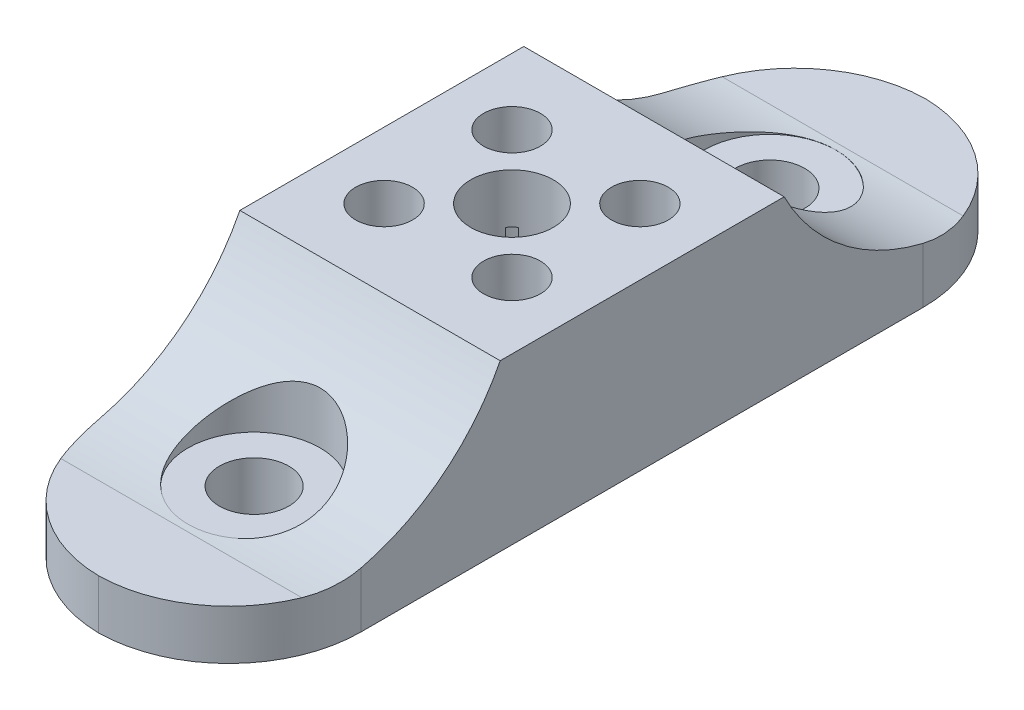
from build123d import *

# Parameters (mm, degrees)
SKETCH1_W               = 20
SKETCH1_H               = 63.5
BOSS_EXTRUDE1_DEPTH     = 12.7
SKETCH2_R               = 3.175
SKETCH2_R_2             = 2.1844
CUT_EXTRUDE1_DEPTH      = 36.62797356
CUT_EXTRUDE2_DEPTH      = 36.62797356
CUT_EXTRUDE2_DEPTH_BACK = 36.62797356
SKETCH4_R               = 3.81
CUT_EXTRUDE3_DEPTH      = 8.89
SKETCH4_3_R             = 3.81
SKETCH4_3_R_2           = 2.1844
SKETCH4_3_R_3           = 5.334
SKETCH4_3_R_4           = 3.175
CUT_EXTRUDE4_DEPTH      = 3.81
CUT_EXTRUDE5_REACH      = 36.454
SKETCH6_R               = 5.08
SKETCH6_R_2             = 2.667
CUT_EXTRUDE6_DEPTH      = 10
CUT_EXTRUDE6_DEPTH_BACK = 35.454239272
SKETCH6_4_R             = 2.159
SKETCH6_4_R_2           = 2.667
FILLET1_R               = 10.16


with BuildPart() as part:
    # Sketch1 → Boss-Extrude1 (new body)
    with BuildSketch(Plane(origin=(0, 0, 0), x_dir=(1, 0, 0), z_dir=(0, 1, 0))):
        Rectangle(SKETCH1_W, SKETCH1_H)
    extrude(amount=BOSS_EXTRUDE1_DEPTH)

    # Sketch2 → Cut-Extrude1 (cut, through all)
    with BuildSketch(Plane(origin=(0, 12.7, 0), x_dir=(1, 0, 0), z_dir=(0, 1, 0))):
        with Locations(Location((0, 0, 0), (0, 0, 270))):
            Circle(SKETCH2_R)
        with Locations(Location((-4.912200098, 4.912200098, 0), (0, 0, 270))):
            Circle(SKETCH2_R_2)
        with Locations(Location((4.912200098, -4.912200098, 0), (0, 0, 270))):
            Circle(SKETCH2_R_2)
        with Locations(Location((4.912200098, 4.912200098, 0), (0, 0, 90))):
            Circle(SKETCH2_R_2)
        with Locations(Location((-4.912200098, -4.912200098, 0), (0, 0, 90))):
            Circle(SKETCH2_R_2)
    extrude(amount=-CUT_EXTRUDE1_DEPTH, mode=Mode.SUBTRACT)

    # Sketch3 → Cut-Extrude2 (cut, two sides: drawn at the far end of the back side and taken through both)
    with BuildSketch(Plane(origin=(0, 0, 0), x_dir=(0, 0, -1), z_dir=(1, 0, 0)).offset(-CUT_EXTRUDE2_DEPTH_BACK)):
        with BuildLine():
            Line((31.75, 3.81), (31.75, 12.7))
            Line((31.75, 12.7), (10.906600098, 12.7))
            ThreePointArc((10.906600098, 12.7), (16.898665682, 6.209564949), (25.4, 3.81))
            Line((25.4, 3.81), (31.75, 3.81))
        make_face()
        with BuildLine():
            ThreePointArc((-25.4, 3.81), (-16.898665682, 6.209564949), (-10.906600098, 12.7))
            Line((-10.906600098, 12.7), (-31.75, 12.7))
            Line((-31.75, 12.7), (-31.75, 3.81))
            Line((-31.75, 3.81), (-25.4, 3.81))
        make_face()
    extrude(amount=CUT_EXTRUDE2_DEPTH + CUT_EXTRUDE2_DEPTH_BACK, mode=Mode.SUBTRACT)

    # Sketch4 → Cut-Extrude3 (cut)
    with BuildSketch(Plane.XZ):
        with Locations((-4.912200098, -4.912200098)):
            Circle(SKETCH4_R)
        with Locations((4.912200098, 4.912200098)):
            Circle(SKETCH4_R)
        with Locations((-4.912200098, 4.912200098)):
            Circle(SKETCH4_R)
        with Locations((4.912200098, -4.912200098)):
            Circle(SKETCH4_R)
    extrude(amount=-CUT_EXTRUDE3_DEPTH, mode=Mode.SUBTRACT)

    # Sketch4<3> → Cut-Extrude4 (cut)
    # profile 1 of 28: a face of its own
    with BuildSketch(Plane.XZ):
        with Locations((-4.912200098, 4.912200098)):
            Circle(SKETCH4_3_R)
        with Locations(Location((-4.912200098, 4.912200098, 0), (0, 0, 270))):
            Circle(SKETCH4_3_R_2, mode=Mode.SUBTRACT)
    # profile 2 of 28: a face of its own
    with BuildSketch(Plane.XZ):
        Circle(SKETCH4_3_R_3)
        with Locations(Location((0, 0, 0), (0, 0, 90))):
            Circle(SKETCH4_3_R_4, mode=Mode.SUBTRACT)
    # profile 3 of 28: a face of its own
    with BuildSketch(Plane.XZ):
        Circle(SKETCH4_3_R_3)
    # profile 4 of 28: a face of its own
    with BuildSketch(Plane.XZ):
        with Locations(Location((-4.912200098, 4.912200098, 0), (0, 0, 270))):
            Circle(SKETCH4_3_R_2)
    # profile 5 of 28: a face of its own
    with BuildSketch(Plane.XZ):
        with Locations((-4.912200098, 4.912200098)):
            Circle(SKETCH4_3_R)
    # profile 6 of 28: a face of its own
    with BuildSketch(Plane.XZ):
        Circle(SKETCH4_3_R_3)
        with Locations(Location((0, 0, 0), (0, 0, 90))):
            Circle(SKETCH4_3_R_4, mode=Mode.SUBTRACT)
    # profile 7 of 28: a face of its own
    with BuildSketch(Plane.XZ):
        with Locations((-4.912200098, -4.912200098)):
            Circle(SKETCH4_3_R)
    # profile 8 of 28: a face of its own
    with BuildSketch(Plane.XZ):
        Circle(SKETCH4_3_R_3)
        with Locations(Location((0, 0, 0), (0, 0, 90))):
            Circle(SKETCH4_3_R_4, mode=Mode.SUBTRACT)
    # profile 9 of 28: a face of its own
    with BuildSketch(Plane.XZ):
        with Locations((-4.912200098, -4.912200098)):
            Circle(SKETCH4_3_R)
        with Locations(Location((-4.912200098, -4.912200098, 0), (0, 0, 90))):
            Circle(SKETCH4_3_R_2, mode=Mode.SUBTRACT)
    # profile 10 of 28: a face of its own
    with BuildSketch(Plane.XZ):
        Circle(SKETCH4_3_R_3)
    # profile 11 of 28: a face of its own
    with BuildSketch(Plane.XZ):
        with Locations(Location((-4.912200098, -4.912200098, 0), (0, 0, 90))):
            Circle(SKETCH4_3_R_2)
    # profile 12 of 28: a face of its own
    with BuildSketch(Plane.XZ):
        with BuildLine():
            ThreePointArc((1.973854475, -2.486870224), (1.04518229, -2.998035854), (0, -3.175))
            Line((0, -3.175), (0, -5.334))
            ThreePointArc((0, -5.334), (0.560277089, -5.304492962), (1.114355409, -5.216298306))
            ThreePointArc((1.114355409, -5.216298306), (1.278123958, -3.767826643), (1.973854475, -2.486870224))
        make_face()
    # profile 13 of 28: a face of its own
    with BuildSketch(Plane.XZ):
        with BuildLine():
            Line((0, -5.334), (0, -3.175))
            ThreePointArc((0, -3.175), (-1.04518229, -2.998035854), (-1.973854475, -2.486870224))
            ThreePointArc((-1.973854475, -2.486870224), (-1.326729639, -3.623595587), (-1.102200098, -4.912200098))
            ThreePointArc((-1.102200098, -4.912200098), (-1.105240139, -5.064370621), (-1.114355409, -5.216298306))
            ThreePointArc((-1.114355409, -5.216298306), (-0.560277089, -5.304492962), (0, -5.334))
        make_face()
    # profile 14 of 28: a face of its own
    with BuildSketch(Plane.XZ):
        with Locations((4.912200098, -4.912200098)):
            Circle(SKETCH4_3_R)
        with Locations(Location((4.912200098, -4.912200098, 0), (0, 0, 270))):
            Circle(SKETCH4_3_R_2, mode=Mode.SUBTRACT)
    # profile 15 of 28: a face of its own
    with BuildSketch(Plane.XZ):
        Circle(SKETCH4_3_R_3)
        with Locations(Location((0, 0, 0), (0, 0, 90))):
            Circle(SKETCH4_3_R_4, mode=Mode.SUBTRACT)
    # profile 16 of 28: a face of its own
    with BuildSketch(Plane.XZ):
        Circle(SKETCH4_3_R_3)
    # profile 17 of 28: a face of its own
    with BuildSketch(Plane.XZ):
        with Locations(Location((4.912200098, -4.912200098, 0), (0, 0, 270))):
            Circle(SKETCH4_3_R_2)
    # profile 18 of 28: a face of its own
    with BuildSketch(Plane.XZ):
        with Locations((4.912200098, -4.912200098)):
            Circle(SKETCH4_3_R)
    # profile 19 of 28: a face of its own
    with BuildSketch(Plane.XZ):
        Circle(SKETCH4_3_R_3)
        with Locations(Location((0, 0, 0), (0, 0, 90))):
            Circle(SKETCH4_3_R_4, mode=Mode.SUBTRACT)
    # profile 20 of 28: a face of its own
    with BuildSketch(Plane.XZ):
        with Locations((4.912200098, 4.912200098)):
            Circle(SKETCH4_3_R)
    # profile 21 of 28: a face of its own
    with BuildSketch(Plane.XZ):
        Circle(SKETCH4_3_R_3)
        with Locations(Location((0, 0, 0), (0, 0, 90))):
            Circle(SKETCH4_3_R_4, mode=Mode.SUBTRACT)
    # profile 22 of 28: a face of its own
    with BuildSketch(Plane.XZ):
        with Locations((4.912200098, 4.912200098)):
            Circle(SKETCH4_3_R)
        with Locations(Location((4.912200098, 4.912200098, 0), (0, 0, 90))):
            Circle(SKETCH4_3_R_2, mode=Mode.SUBTRACT)
    # profile 23 of 28: a face of its own
    with BuildSketch(Plane.XZ):
        Circle(SKETCH4_3_R_3)
    # profile 24 of 28: a face of its own
    with BuildSketch(Plane.XZ):
        with Locations(Location((4.912200098, 4.912200098, 0), (0, 0, 90))):
            Circle(SKETCH4_3_R_2)
    # profile 25 of 28: a face of its own
    with BuildSketch(Plane.XZ):
        with BuildLine():
            Line((0, 3.175), (0, 5.334))
            ThreePointArc((0, 5.334), (-0.560277089, 5.304492962), (-1.114355409, 5.216298306))
            ThreePointArc((-1.114355409, 5.216298306), (-1.105240139, 5.064370621), (-1.102200098, 4.912200098))
            ThreePointArc((-1.102200098, 4.912200098), (-1.326729639, 3.623595587), (-1.973854475, 2.486870224))
            ThreePointArc((-1.973854475, 2.486870224), (-1.04518229, 2.998035854), (0, 3.175))
        make_face()
    # profile 26 of 28: a face of its own
    with BuildSketch(Plane.XZ):
        with BuildLine():
            ThreePointArc((1.114355409, 5.216298306), (0.560277089, 5.304492962), (0, 5.334))
            Line((0, 5.334), (0, 3.175))
            ThreePointArc((0, 3.175), (1.04518229, 2.998035854), (1.973854475, 2.486870224))
            ThreePointArc((1.973854475, 2.486870224), (1.278123958, 3.767826643), (1.114355409, 5.216298306))
        make_face()
    # profile 27 of 28: a face of its own
    with BuildSketch(Plane.XZ):
        with BuildLine():
            ThreePointArc((1.973854475, 2.486870224), (1.04518229, 2.998035854), (0, 3.175))
            Line((0, 3.175), (0, -3.175))
            ThreePointArc((0, -3.175), (1.04518229, -2.998035854), (1.973854475, -2.486870224))
            ThreePointArc((1.973854475, -2.486870224), (2.218123262, -2.218123262), (2.486870224, -1.973854475))
            ThreePointArc((2.486870224, -1.973854475), (2.998035854, -1.04518229), (3.175, 0))
            ThreePointArc((3.175, 0), (2.998035854, 1.04518229), (2.486870224, 1.973854475))
            ThreePointArc((2.486870224, 1.973854475), (2.218123262, 2.218123262), (1.973854475, 2.486870224))
        make_face()
    # profile 28 of 28: a face of its own
    with BuildSketch(Plane.XZ):
        with BuildLine():
            Line((0, -3.175), (0, 3.175))
            ThreePointArc((0, 3.175), (-1.04518229, 2.998035854), (-1.973854475, 2.486870224))
            ThreePointArc((-1.973854475, 2.486870224), (-2.218123262, 2.218123262), (-2.486870224, 1.973854475))
            ThreePointArc((-2.486870224, 1.973854475), (-3.175, 0), (-2.486870224, -1.973854475))
            ThreePointArc((-2.486870224, -1.973854475), (-2.218123262, -2.218123262), (-1.973854475, -2.486870224))
            ThreePointArc((-1.973854475, -2.486870224), (-1.04518229, -2.998035854), (0, -3.175))
        make_face()
    extrude(amount=-CUT_EXTRUDE4_DEPTH, mode=Mode.SUBTRACT)

    # Cut-Extrude5: up to this face of the body (flat: up to its plane)
    cut_extrude5_end = Plane(part.part.faces().sort_by_distance((9.704058164, 12.7, 0))[0])
    # Sketch6 → Cut-Extrude5 (cut, up to the picked face)
    with BuildSketch(Plane(origin=(0, 3.81, 0), x_dir=(1, 0, 0), z_dir=(0, 1, 0)), mode=Mode.PRIVATE) as cut_extrude5_sk1:
        with Locations(Location((0, 19.812, 0), (0, 0, 90))):
            Circle(SKETCH6_R)
    cut_extrude5_tool1 = split(extrude(cut_extrude5_sk1.sketch, amount=CUT_EXTRUDE5_REACH, mode=Mode.PRIVATE), bisect_by=cut_extrude5_end, keep=Keep.BOTH, mode=Mode.PRIVATE)
    # Sketch6 → Cut-Extrude5 (cut, up to the picked face)
    with BuildSketch(Plane(origin=(0, 3.81, 0), x_dir=(1, 0, 0), z_dir=(0, 1, 0)), mode=Mode.PRIVATE) as cut_extrude5_sk2:
        with Locations(Location((0, -19.812, 0), (0, 0, 90))):
            Circle(SKETCH6_R)
        with Locations(Location((0, -19.812, 0), (0, 0, 90))):
            Circle(SKETCH6_R_2, mode=Mode.SUBTRACT)
    cut_extrude5_tool2 = split(extrude(cut_extrude5_sk2.sketch, amount=CUT_EXTRUDE5_REACH, mode=Mode.PRIVATE), bisect_by=cut_extrude5_end, keep=Keep.BOTH, mode=Mode.PRIVATE)
    add(cut_extrude5_tool1.solids().sort_by(Axis((0, 3.81, -19.812), (0, 1, 0)))[0], mode=Mode.SUBTRACT)
    add(cut_extrude5_tool2.solids().sort_by(Axis((0, 3.81, 24.748316), (0, 1, 0)))[0], mode=Mode.SUBTRACT)

    # Sketch6<4> → Cut-Extrude6 (cut, two sides: drawn at the far end of the back side and taken through both)
    with BuildSketch(Plane(origin=(0, 3.81, 0), x_dir=(1, 0, 0), z_dir=(0, 1, 0)).offset(-CUT_EXTRUDE6_DEPTH_BACK)):
        with Locations((0, 19.812)):
            Circle(SKETCH6_4_R)
        with Locations((0, -19.812)):
            Circle(SKETCH6_4_R)
        with Locations(Location((0, 19.812, 0), (0, 0, 270))):
            Circle(SKETCH6_4_R_2)
        with Locations(Location((0, -19.812, 0), (0, 0, 270))):
            Circle(SKETCH6_4_R_2)
    extrude(amount=CUT_EXTRUDE6_DEPTH + CUT_EXTRUDE6_DEPTH_BACK, mode=Mode.SUBTRACT)

    # Fillet1
    # the kernel refuses this fillet: 10.16 mm, written as the material it takes off along each edge
    with BuildSketch(Plane(origin=(10, -25.4, 31.75), x_dir=(0, 0, -1), z_dir=(0, 1, 0)), Plane(origin=(10, -25.4, -31.75), x_dir=(-1, 0, 0), z_dir=(0, 1, 0)), Plane(origin=(-10, -25.4, 31.75), x_dir=(1, 0, 0), z_dir=(0, 1, 0))) as fillet1_piece_1:
        with BuildLine():
            CenterArc((FILLET1_R, FILLET1_R), FILLET1_R, 180, 90)
            Line((0, FILLET1_R), (0, 0))
            Line((0, 0), (FILLET1_R, 0))
        make_face()
    extrude(amount=54.61, mode=Mode.SUBTRACT)
    with BuildSketch(Plane(origin=(-10, -25.4, -31.75), x_dir=(1, 0, 0), z_dir=(0, 1, 0))) as fillet1_piece_2:
        with BuildLine():
            CenterArc((FILLET1_R, -FILLET1_R), FILLET1_R, 90, 90)
            Line((0, -FILLET1_R), (0, 0))
            Line((0, 0), (FILLET1_R, 0))
        make_face()
    extrude(amount=54.61, mode=Mode.SUBTRACT)


solid = part.part
